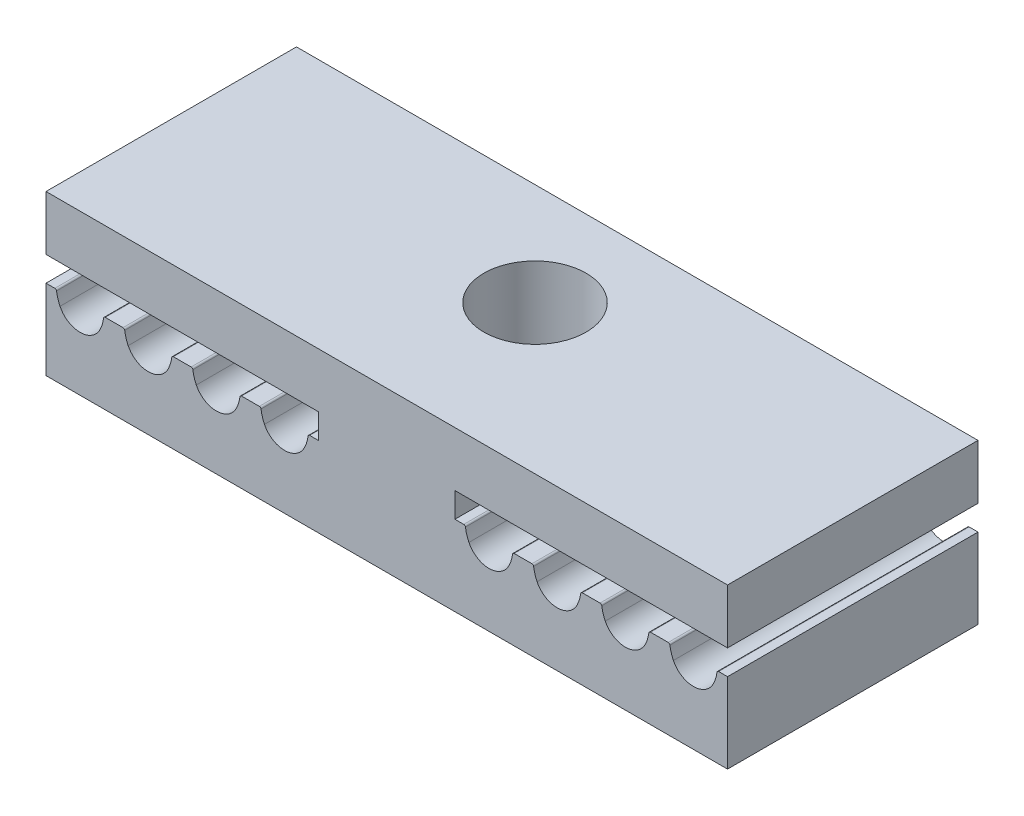
from build123d import *
from OCP.BRepAlgoAPI import BRepAlgoAPI_Cut
from OCP.TopTools import TopTools_ListOfShape

# Parameters (mm, degrees)
BOSS_EXTRUDE1_DEPTH     = 6
SKETCH2_R               = 1.5
CUT_EXTRUDE1_DEPTH      = 17.153773553
CUT_EXTRUDE2_START      = -6
CUT_EXTRUDE2_DEPTH      = 6
SALIENTE_EXTRUIR1_DEPTH = 1.35
CORTAR_EXTRUIR1_START   = -0.3
CROQUIS5_W              = 20
CROQUIS5_H              = 7.35
CROQUIS5_R              = 1.5
CORTAR_EXTRUIR1_DEPTH   = 0.3
CROQUIS6_W              = 20
CROQUIS6_H              = 7.35
CROQUIS6_R              = 1.5
CORTAR_EXTRUIR2_DEPTH   = 0.4


with BuildPart() as part:
    # Sketch1 → Boss-Extrude1 (new body)
    with BuildSketch(Plane.XY):
        with BuildLine():
            Line((-0.259824575, -0.254), (0, -0.254))
            Line((0, -0.254), (0.259824575, -0.254))
            ThreePointArc((0.259824575, -0.254), (0.358731646, -0.291228588), (0.408543109, -0.384434783))
            ThreePointArc((0.408543109, -0.384434783), (0.442388286, -0.542062154), (0.501123596, -0.692202247))
            ThreePointArc((0.501123596, -0.692202247), (1, -1.004), (1.498876404, -0.692202247))
            ThreePointArc((1.498876404, -0.692202247), (1.557611714, -0.542062154), (1.591456891, -0.384434783))
            ThreePointArc((1.591456891, -0.384434783), (1.641268354, -0.291228588), (1.740175425, -0.254))
            Line((1.740175425, -0.254), (2, -0.254))
            Line((2, -0.254), (2.259824575, -0.254))
            ThreePointArc((2.259824575, -0.254), (2.358731646, -0.291228588), (2.408543109, -0.384434783))
            ThreePointArc((2.408543109, -0.384434783), (2.442388286, -0.542062154), (2.501123596, -0.692202247))
            ThreePointArc((2.501123596, -0.692202247), (3, -1.004), (3.498876404, -0.692202247))
            ThreePointArc((3.498876404, -0.692202247), (3.557611714, -0.542062154), (3.591456891, -0.384434783))
            ThreePointArc((3.591456891, -0.384434783), (3.641268354, -0.291228588), (3.740175425, -0.254))
            Line((3.740175425, -0.254), (4, -0.254))
            Line((4, -0.254), (4.259824575, -0.254))
            ThreePointArc((4.259824575, -0.254), (4.358731646, -0.291228588), (4.408543109, -0.384434783))
            ThreePointArc((4.408543109, -0.384434783), (4.442388286, -0.542062154), (4.501123596, -0.692202247))
            ThreePointArc((4.501123596, -0.692202247), (5, -1.004), (5.498876404, -0.692202247))
            ThreePointArc((5.498876404, -0.692202247), (5.557611714, -0.542062154), (5.591456891, -0.384434783))
            ThreePointArc((5.591456891, -0.384434783), (5.641268354, -0.291228588), (5.740175425, -0.254))
            Line((5.740175425, -0.254), (6, -0.254))
            Line((6, -0.254), (6, -3.004))
            Line((6, -3.004), (-3.198960597, -3.004))
            Line((-3.198960597, -3.004), (-4, -3.004))
            Line((-4, -3.004), (-4, 2.376))
            Line((-4, 2.376), (6, 2.376))
            Line((6, 2.376), (6, 0.376))
            Line((6, 0.376), (-2, 0.376))
            Line((-2, 0.376), (-2, -0.254))
            Line((-2, -0.254), (-1.740175425, -0.254))
            ThreePointArc((-1.740175425, -0.254), (-1.641268354, -0.291228588), (-1.591456891, -0.384434783))
            ThreePointArc((-1.591456891, -0.384434783), (-1.557611714, -0.542062154), (-1.498876404, -0.692202247))
            ThreePointArc((-1.498876404, -0.692202247), (-1, -1.004), (-0.501123596, -0.692202247))
            ThreePointArc((-0.501123596, -0.692202247), (-0.442388286, -0.542062154), (-0.408543109, -0.384434783))
            ThreePointArc((-0.408543109, -0.384434783), (-0.358731646, -0.291228588), (-0.259824575, -0.254))
        make_face()
    extrude(amount=BOSS_EXTRUDE1_DEPTH)

    # Mirror1: part across plane


with BuildPart() as part_1:
    add(part.part)
    add(part.part.mirror(Plane(origin=(-4, 2.376, 6), x_dir=(0, 0, 1), z_dir=(1, 0, 0))))

    # Sketch2 → Cut-Extrude1 (cut, through all)
    with BuildSketch(Plane(origin=(0, 2.376, 0), x_dir=(1, 0, 0), z_dir=(0, 1, 0))):
        with Locations(Location((-4, -3, 0), (0, 0, 180))):
            Circle(SKETCH2_R)
    extrude(amount=-CUT_EXTRUDE1_DEPTH, mode=Mode.SUBTRACT)


with BuildPart() as cut_extrude2_tool:
    # Cut-Extrude2: read off the stored shape, not the designer's step
    # Cut-Extrude2 outline → Cut-Extrude2 (new body)
    with BuildSketch(Plane.XY.offset(6).offset(CUT_EXTRUDE2_START)):
        with BuildLine():
            Line((-1.740175425, -0.254), (-2, -0.254))
            Line((-2, -0.254), (-2, -0.35400144))
            Line((-2, -0.35400144), (-1.740174871, -0.354))
            ThreePointArc((-1.740174871, -0.354), (-1.707206193, -0.366409712), (-1.690602581, -0.397478261))
            ThreePointArc((-1.690602581, -0.397478261), (-1.653372886, -0.570868369), (-1.588764045, -0.736022472))
            ThreePointArc((-1.588764045, -0.736022472), (-1, -1.104), (-0.411235955, -0.736022472))
            ThreePointArc((-0.411235955, -0.736022472), (-0.346627114, -0.570868369), (-0.309397419, -0.397478261))
            ThreePointArc((-0.309397419, -0.397478261), (-0.292793599, -0.366409529), (-0.259824575, -0.354))
            Line((-0.259824575, -0.354), (0.259824575, -0.354))
            ThreePointArc((0.259824575, -0.354), (0.292793599, -0.366409529), (0.309397419, -0.397478261))
            ThreePointArc((0.309397419, -0.397478261), (0.346627114, -0.570868369), (0.411235955, -0.736022472))
            ThreePointArc((0.411235955, -0.736022472), (1, -1.104), (1.588764045, -0.736022472))
            ThreePointArc((1.588764045, -0.736022472), (1.653372886, -0.570868369), (1.690602581, -0.397478261))
            ThreePointArc((1.690602581, -0.397478261), (1.707206401, -0.366409529), (1.740175425, -0.354))
            Line((1.740175425, -0.354), (2.259824575, -0.35400144))
            ThreePointArc((2.259824575, -0.35400144), (2.292793599, -0.366410969), (2.309397419, -0.397479701))
            ThreePointArc((2.309397419, -0.397479701), (2.346627114, -0.570869809), (2.411235955, -0.736023912))
            ThreePointArc((2.411235955, -0.736023912), (3, -1.10400144), (3.588764045, -0.736023912))
            ThreePointArc((3.588764045, -0.736023912), (3.653372886, -0.570869809), (3.690602581, -0.397479701))
            ThreePointArc((3.690602581, -0.397479701), (3.707206401, -0.366410969), (3.740175425, -0.35400144))
            Line((3.740175425, -0.35400144), (4.259824575, -0.35400288))
            ThreePointArc((4.259824575, -0.35400288), (4.292793599, -0.366412409), (4.309397419, -0.397481141))
            ThreePointArc((4.309397419, -0.397481141), (4.346627114, -0.570871249), (4.411235955, -0.736025352))
            ThreePointArc((4.411235955, -0.736025352), (5, -1.10400288), (5.588764045, -0.736025352))
            ThreePointArc((5.588764045, -0.736025352), (5.653372886, -0.570871249), (5.690602581, -0.397481141))
            ThreePointArc((5.690602581, -0.397481141), (5.707206401, -0.366412409), (5.740175425, -0.35400288))
            Line((5.740175425, -0.35400288), (5.999999446, -0.35400432))
            Line((5.999999446, -0.35400432), (6, -0.254))
            Line((6, -0.254), (5.740175425, -0.254))
            ThreePointArc((5.740175425, -0.254), (5.641268354, -0.291228588), (5.591456891, -0.384434783))
            ThreePointArc((5.591456891, -0.384434783), (5.557611714, -0.542062154), (5.498876404, -0.692202247))
            ThreePointArc((5.498876404, -0.692202247), (5, -1.004), (4.501123596, -0.692202247))
            ThreePointArc((4.501123596, -0.692202247), (4.442388286, -0.542062154), (4.408543109, -0.384434783))
            ThreePointArc((4.408543109, -0.384434783), (4.358731646, -0.291228588), (4.259824575, -0.254))
            Line((4.259824575, -0.254), (3.740175425, -0.254))
            ThreePointArc((3.740175425, -0.254), (3.641268354, -0.291228588), (3.591456891, -0.384434783))
            ThreePointArc((3.591456891, -0.384434783), (3.557611714, -0.542062154), (3.498876404, -0.692202247))
            ThreePointArc((3.498876404, -0.692202247), (3, -1.004), (2.501123596, -0.692202247))
            ThreePointArc((2.501123596, -0.692202247), (2.442388286, -0.542062154), (2.408543109, -0.384434783))
            ThreePointArc((2.408543109, -0.384434783), (2.358731646, -0.291228588), (2.259824575, -0.254))
            Line((2.259824575, -0.254), (1.740175425, -0.254))
            ThreePointArc((1.740175425, -0.254), (1.641268354, -0.291228588), (1.591456891, -0.384434783))
            ThreePointArc((1.591456891, -0.384434783), (1.557611714, -0.542062154), (1.498876404, -0.692202247))
            ThreePointArc((1.498876404, -0.692202247), (1, -1.004), (0.501123596, -0.692202247))
            ThreePointArc((0.501123596, -0.692202247), (0.442388286, -0.542062154), (0.408543109, -0.384434783))
            ThreePointArc((0.408543109, -0.384434783), (0.358731646, -0.291228588), (0.259824575, -0.254))
            Line((0.259824575, -0.254), (-0.259824575, -0.254))
            ThreePointArc((-0.259824575, -0.254), (-0.358731646, -0.291228588), (-0.408543109, -0.384434783))
            ThreePointArc((-0.408543109, -0.384434783), (-0.442388286, -0.542062154), (-0.501123596, -0.692202247))
            ThreePointArc((-0.501123596, -0.692202247), (-1, -1.004), (-1.498876404, -0.692202247))
            ThreePointArc((-1.498876404, -0.692202247), (-1.557611714, -0.542062154), (-1.591456891, -0.384434783))
            ThreePointArc((-1.591456891, -0.384434783), (-1.641268354, -0.291228588), (-1.740175425, -0.254))
        make_face()
        with BuildLine():
            Line((-6.259825129, -0.354), (-6, -0.35400144))
            Line((-6, -0.35400144), (-6, -0.254))
            Line((-6, -0.254), (-6.259824575, -0.254))
            ThreePointArc((-6.259824575, -0.254), (-6.358731646, -0.291228588), (-6.408543109, -0.384434783))
            ThreePointArc((-6.408543109, -0.384434783), (-6.442388286, -0.542062154), (-6.501123596, -0.692202247))
            ThreePointArc((-6.501123596, -0.692202247), (-7, -1.004), (-7.498876404, -0.692202247))
            ThreePointArc((-7.498876404, -0.692202247), (-7.557611714, -0.542062154), (-7.591456891, -0.384434783))
            ThreePointArc((-7.591456891, -0.384434783), (-7.641268354, -0.291228588), (-7.740175425, -0.254))
            Line((-7.740175425, -0.254), (-8.259824575, -0.254))
            ThreePointArc((-8.259824575, -0.254), (-8.358731646, -0.291228588), (-8.408543109, -0.384434783))
            ThreePointArc((-8.408543109, -0.384434783), (-8.442388286, -0.542062154), (-8.501123596, -0.692202247))
            ThreePointArc((-8.501123596, -0.692202247), (-9, -1.004), (-9.498876404, -0.692202247))
            ThreePointArc((-9.498876404, -0.692202247), (-9.557611714, -0.542062154), (-9.591456891, -0.384434783))
            ThreePointArc((-9.591456891, -0.384434783), (-9.641268354, -0.291228588), (-9.740175425, -0.254))
            Line((-9.740175425, -0.254), (-10.259824575, -0.254))
            ThreePointArc((-10.259824575, -0.254), (-10.358731646, -0.291228588), (-10.408543109, -0.384434783))
            ThreePointArc((-10.408543109, -0.384434783), (-10.442388286, -0.542062154), (-10.501123596, -0.692202247))
            ThreePointArc((-10.501123596, -0.692202247), (-11, -1.004), (-11.498876404, -0.692202247))
            ThreePointArc((-11.498876404, -0.692202247), (-11.557611714, -0.542062154), (-11.591456891, -0.384434783))
            ThreePointArc((-11.591456891, -0.384434783), (-11.641268354, -0.291228588), (-11.740175425, -0.254))
            Line((-11.740175425, -0.254), (-12.259824575, -0.254))
            ThreePointArc((-12.259824575, -0.254), (-12.358731646, -0.291228588), (-12.408543109, -0.384434783))
            ThreePointArc((-12.408543109, -0.384434783), (-12.442388286, -0.542062154), (-12.501123596, -0.692202247))
            ThreePointArc((-12.501123596, -0.692202247), (-13, -1.004), (-13.498876404, -0.692202247))
            ThreePointArc((-13.498876404, -0.692202247), (-13.557611714, -0.542062154), (-13.591456891, -0.384434783))
            ThreePointArc((-13.591456891, -0.384434783), (-13.641268354, -0.291228588), (-13.740175425, -0.254))
            Line((-13.740175425, -0.254), (-14, -0.254))
            Line((-14, -0.254), (-14, -0.35400396))
            Line((-14, -0.35400396), (-13.740175425, -0.35400288))
            ThreePointArc((-13.740175425, -0.35400288), (-13.707206401, -0.366412409), (-13.690602581, -0.397481141))
            ThreePointArc((-13.690602581, -0.397481141), (-13.653372886, -0.570871249), (-13.588764045, -0.736025352))
            ThreePointArc((-13.588764045, -0.736025352), (-13, -1.10400288), (-12.411235955, -0.736025352))
            ThreePointArc((-12.411235955, -0.736025352), (-12.346627114, -0.570871249), (-12.309397419, -0.397481141))
            ThreePointArc((-12.309397419, -0.397481141), (-12.292793599, -0.366412409), (-12.259824575, -0.35400288))
            Line((-12.259824575, -0.35400288), (-11.740175425, -0.35400144))
            ThreePointArc((-11.740175425, -0.35400144), (-11.707206401, -0.366410969), (-11.690602581, -0.397479701))
            ThreePointArc((-11.690602581, -0.397479701), (-11.653372886, -0.570869809), (-11.588764045, -0.736023912))
            ThreePointArc((-11.588764045, -0.736023912), (-11, -1.10400144), (-10.411235955, -0.736023912))
            ThreePointArc((-10.411235955, -0.736023912), (-10.346627114, -0.570869809), (-10.309397419, -0.397479701))
            ThreePointArc((-10.309397419, -0.397479701), (-10.292793599, -0.366410969), (-10.259824575, -0.35400144))
            Line((-10.259824575, -0.35400144), (-9.740175425, -0.354))
            ThreePointArc((-9.740175425, -0.354), (-9.707206401, -0.366409529), (-9.690602581, -0.397478261))
            ThreePointArc((-9.690602581, -0.397478261), (-9.653372886, -0.570868369), (-9.588764045, -0.736022472))
            ThreePointArc((-9.588764045, -0.736022472), (-9, -1.104), (-8.411235955, -0.736022472))
            ThreePointArc((-8.411235955, -0.736022472), (-8.346627114, -0.570868369), (-8.309397419, -0.397478261))
            ThreePointArc((-8.309397419, -0.397478261), (-8.292793599, -0.366409529), (-8.259824575, -0.354))
            Line((-8.259824575, -0.354), (-7.740175425, -0.354))
            ThreePointArc((-7.740175425, -0.354), (-7.707206401, -0.366409529), (-7.690602581, -0.397478261))
            ThreePointArc((-7.690602581, -0.397478261), (-7.653372886, -0.570868369), (-7.588764045, -0.736022472))
            ThreePointArc((-7.588764045, -0.736022472), (-7, -1.104), (-6.411235955, -0.736022472))
            ThreePointArc((-6.411235955, -0.736022472), (-6.346627114, -0.570868369), (-6.309397419, -0.397478261))
            ThreePointArc((-6.309397419, -0.397478261), (-6.292793807, -0.366409712), (-6.259825129, -0.354))
        make_face()
    extrude(amount=CUT_EXTRUDE2_DEPTH)


with BuildPart() as part_2:
    add(part_1.part)

    # Cut-Extrude2: cut by cut_extrude2_tool, with a tolerance
    cut_extrude2_stock = TopTools_ListOfShape()
    cut_extrude2_stock.Append(part_2.part.wrapped)
    cut_extrude2_tools = TopTools_ListOfShape()
    cut_extrude2_tools.Append(cut_extrude2_tool.part.wrapped)
    cut_extrude2_cut = BRepAlgoAPI_Cut()
    cut_extrude2_cut.SetArguments(cut_extrude2_stock)
    cut_extrude2_cut.SetTools(cut_extrude2_tools)
    cut_extrude2_cut.SetFuzzyValue(0.00001)
    cut_extrude2_cut.Build()
    add(Compound.cast(cut_extrude2_cut.Shape()).solids(), mode=Mode.REPLACE)


with BuildPart() as saliente_extruir1_tool:
    # Croquis1 → Saliente-Extruir1 (new body)
    with BuildSketch(Plane.XY.offset(6)):
        with BuildLine():
            Line((-6, -0.35400144), (-6.259825129, -0.354))
            ThreePointArc((-6.259825129, -0.354), (-6.292793807, -0.366409712), (-6.309397419, -0.397478261))
            ThreePointArc((-6.309397419, -0.397478261), (-6.346627114, -0.570868369), (-6.411235955, -0.736022472))
            ThreePointArc((-6.411235955, -0.736022472), (-7, -1.104), (-7.588764045, -0.736022472))
            ThreePointArc((-7.588764045, -0.736022472), (-7.653372886, -0.570868369), (-7.690602581, -0.397478261))
            ThreePointArc((-7.690602581, -0.397478261), (-7.707206401, -0.366409529), (-7.740175425, -0.354))
            Line((-7.740175425, -0.354), (-8.259824575, -0.354))
            ThreePointArc((-8.259824575, -0.354), (-8.292793599, -0.366409529), (-8.309397419, -0.397478261))
            ThreePointArc((-8.309397419, -0.397478261), (-8.346627114, -0.570868369), (-8.411235955, -0.736022472))
            ThreePointArc((-8.411235955, -0.736022472), (-9, -1.104), (-9.588764045, -0.736022472))
            ThreePointArc((-9.588764045, -0.736022472), (-9.653372886, -0.570868369), (-9.690602581, -0.397478261))
            ThreePointArc((-9.690602581, -0.397478261), (-9.707206401, -0.366409529), (-9.740175425, -0.354))
            Line((-9.740175425, -0.354), (-9.999999446, -0.35400144))
            Line((-9.999999446, -0.35400144), (-10.259824575, -0.35400144))
            ThreePointArc((-10.259824575, -0.35400144), (-10.292793599, -0.366410969), (-10.309397419, -0.397479701))
            ThreePointArc((-10.309397419, -0.397479701), (-10.346627114, -0.570869809), (-10.411235955, -0.736023912))
            ThreePointArc((-10.411235955, -0.736023912), (-11, -1.10400144), (-11.588764045, -0.736023912))
            ThreePointArc((-11.588764045, -0.736023912), (-11.653372886, -0.570869809), (-11.690602581, -0.397479701))
            ThreePointArc((-11.690602581, -0.397479701), (-11.707206401, -0.366410969), (-11.740175425, -0.35400144))
            Line((-11.740175425, -0.35400144), (-11.999999446, -0.35400288))
            Line((-11.999999446, -0.35400288), (-12.259824575, -0.35400288))
            ThreePointArc((-12.259824575, -0.35400288), (-12.292793599, -0.366412409), (-12.309397419, -0.397481141))
            ThreePointArc((-12.309397419, -0.397481141), (-12.346627114, -0.570871249), (-12.411235955, -0.736025352))
            ThreePointArc((-12.411235955, -0.736025352), (-13, -1.10400288), (-13.588764045, -0.736025352))
            ThreePointArc((-13.588764045, -0.736025352), (-13.653372886, -0.570871249), (-13.690602581, -0.397481141))
            ThreePointArc((-13.690602581, -0.397481141), (-13.707206401, -0.366412409), (-13.740175425, -0.35400288))
            Line((-13.740175425, -0.35400288), (-13.999999446, -0.35400432))
            Line((-13.999999446, -0.35400432), (-14, -3.004))
            Line((-14, -3.004), (6, -3.004))
            Line((6, -3.004), (5.999999446, -0.35400432))
            Line((5.999999446, -0.35400432), (5.740175425, -0.35400288))
            ThreePointArc((5.740175425, -0.35400288), (5.707206401, -0.366412409), (5.690602581, -0.397481141))
            ThreePointArc((5.690602581, -0.397481141), (5.653372886, -0.570871249), (5.588764045, -0.736025352))
            ThreePointArc((5.588764045, -0.736025352), (5, -1.10400288), (4.411235955, -0.736025352))
            ThreePointArc((4.411235955, -0.736025352), (4.346627114, -0.570871249), (4.309397419, -0.397481141))
            ThreePointArc((4.309397419, -0.397481141), (4.292793599, -0.366412409), (4.259824575, -0.35400288))
            Line((4.259824575, -0.35400288), (3.999999446, -0.35400288))
            Line((3.999999446, -0.35400288), (3.740175425, -0.35400144))
            ThreePointArc((3.740175425, -0.35400144), (3.707206401, -0.366410969), (3.690602581, -0.397479701))
            ThreePointArc((3.690602581, -0.397479701), (3.653372886, -0.570869809), (3.588764045, -0.736023912))
            ThreePointArc((3.588764045, -0.736023912), (3, -1.10400144), (2.411235955, -0.736023912))
            ThreePointArc((2.411235955, -0.736023912), (2.346627114, -0.570869809), (2.309397419, -0.397479701))
            ThreePointArc((2.309397419, -0.397479701), (2.292793599, -0.366410969), (2.259824575, -0.35400144))
            Line((2.259824575, -0.35400144), (1.999999446, -0.35400144))
            Line((1.999999446, -0.35400144), (1.740175425, -0.354))
            ThreePointArc((1.740175425, -0.354), (1.707206401, -0.366409529), (1.690602581, -0.397478261))
            ThreePointArc((1.690602581, -0.397478261), (1.653372886, -0.570868369), (1.588764045, -0.736022472))
            ThreePointArc((1.588764045, -0.736022472), (1, -1.104), (0.411235955, -0.736022472))
            ThreePointArc((0.411235955, -0.736022472), (0.346627114, -0.570868369), (0.309397419, -0.397478261))
            ThreePointArc((0.309397419, -0.397478261), (0.292793599, -0.366409529), (0.259824575, -0.354))
            Line((0.259824575, -0.354), (-0.259824575, -0.354))
            ThreePointArc((-0.259824575, -0.354), (-0.292793599, -0.366409529), (-0.309397419, -0.397478261))
            ThreePointArc((-0.309397419, -0.397478261), (-0.346627114, -0.570868369), (-0.411235955, -0.736022472))
            ThreePointArc((-0.411235955, -0.736022472), (-1, -1.104), (-1.588764045, -0.736022472))
            ThreePointArc((-1.588764045, -0.736022472), (-1.653372886, -0.570868369), (-1.690602581, -0.397478261))
            ThreePointArc((-1.690602581, -0.397478261), (-1.707206193, -0.366409712), (-1.740174871, -0.354))
            Line((-1.740174871, -0.354), (-2, -0.35400144))
            Line((-2, -0.35400144), (-2, 0.376))
            Line((-2, 0.376), (6, 0.376))
            Line((6, 0.376), (6, 2.376))
            Line((6, 2.376), (-14, 2.376))
            Line((-14, 2.376), (-14, 0.376))
            Line((-14, 0.376), (-6, 0.376))
            Line((-6, 0.376), (-6, -0.35400144))
        make_face()
    extrude(amount=SALIENTE_EXTRUIR1_DEPTH)


with BuildPart() as part_3:
    add(part_2.part)


with BuildPart() as part_4:
    # Saliente-Extruir1: joined with saliente_extruir1_tool
    add(part_3.part.fuse(saliente_extruir1_tool.part, tol=0.00001))

    # Croquis5 → Cortar-Extruir1 (cut)
    with BuildSketch(Plane.XZ.offset(3.004).offset(CORTAR_EXTRUIR1_START)):
        with Locations((-4, 3.675)):
            Rectangle(CROQUIS5_W, CROQUIS5_H)
        with Locations(Location((-4, 3, 0), (0, 0, 180))):
            Circle(CROQUIS5_R, mode=Mode.SUBTRACT)
    extrude(amount=CORTAR_EXTRUIR1_DEPTH, mode=Mode.SUBTRACT)

    # Croquis6 → Cortar-Extruir2 (cut)
    with BuildSketch(Plane(origin=(0, 2.376, 0), x_dir=(1, 0, 0), z_dir=(0, 1, 0))):
        with Locations((-4, -3.675)):
            Rectangle(CROQUIS6_W, CROQUIS6_H)
        with Locations(Location((-4, -3, 0), (0, 0, 270))):
            Circle(CROQUIS6_R, mode=Mode.SUBTRACT)
    extrude(amount=-CORTAR_EXTRUIR2_DEPTH, mode=Mode.SUBTRACT)


solid = part_4.part
